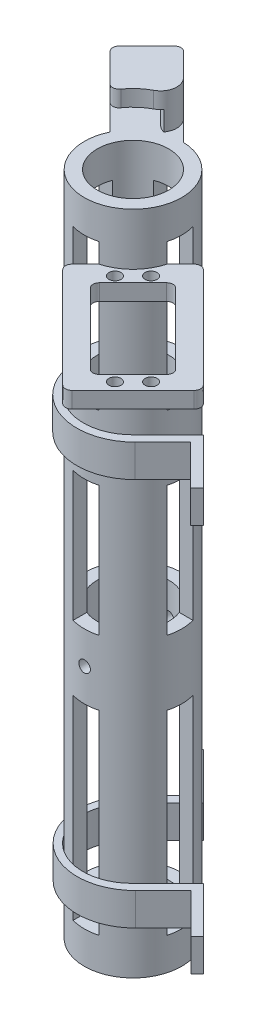
from build123d import *

# Parameters (mm, degrees)
SKETCH1_R                            = 19.05
SKETCH1_R_2                          = 13.97
BOSS_EXTRUDE1_DEPTH                  = 260.35
SKETCH2_R                            = 13.97
BOSS_EXTRUDE2_DEPTH                  = 6.35
CUT_EXTRUDE1_DEPTH                   = 264.45690084
CUT_EXTRUDE1_DEPTH_BACK              = 264.45690084
SKETCH3_R                            = 2.2479
CUT_EXTRUDE5_DEPTH                   = 262.740190953
CUT_EXTRUDE5_DEPTH_BACK              = 262.740190953
SKETCH5_W                            = 10.16
SKETCH5_H                            = 76.2
SKETCH5_H_2                          = 50.8
SKETCH5_H_3                          = 57.15
CUT_EXTRUDE6_DEPTH                   = 262.740190953
CUT_EXTRUDE6_DEPTH_BACK              = 262.740190953
SKETCH8_W                            = 10.16
SKETCH8_H                            = 76.2
SKETCH8_H_2                          = 50.8
SKETCH8_H_3                          = 57.15
SKETCH7_R                            = 6.35
CUT_EXTRUDE4_DEPTH                   = 256.424754201
SKETCH9_W                            = 38.862
SKETCH9_H                            = 6.35
BOSS_EXTRUDE3_DEPTH                  = 8.89
SKETCH10_W                           = 7.62
SKETCH10_H                           = 6.35
BOSS_EXTRUDE4_DEPTH                  = 51.562
BOSS_EXTRUDE5_REACH                  = 279.895
SKETCH11_W                           = 7.62
SKETCH11_H                           = 6.35
FILLET1_R                            = 2.54
CUT_EXTRUDE7_REACH                   = 260.109
SKETCH12_R                           = 2.35585
SKETCH17_W                           = 20.32
SKETCH17_H                           = 6.35
BOSS_EXTRUDE6_DEPTH                  = 20.32
BOSS_EXTRUDE6_DIRECTION_2_REACH      = 286.223
BOSS_EXTRUDE6_DIRECTION_2_END_RADIUS = 19.05
BOSS_EXTRUDE8_DEPTH                  = 13.97
CUT_EXTRUDE8_START                   = -13.97
CUT_EXTRUDE8_DEPTH                   = 7.62
FILLET3_R                            = 2.54
FILLET4_R                            = 6.35
BOSS_EXTRUDE9_DEPTH                  = 12.7
FILLET7_R                            = 19.304
FILLET8_RADIUS                       = 22.733
FILLET8_LENGTH                       = 12.7
SKETCH23_R                           = 2.5527
CUT_EXTRUDE9_DEPTH                   = 12.7
BOSS_EXTRUDE10_DEPTH                 = 6.35
BOSS_EXTRUDE10_DEPTH_BACK            = 6.35
FILLET9_R                            = 19.304
FILLET10_RADIUS                      = 22.7965
FILLET10_LENGTH                      = 12.7
SKETCH25_R                           = 2.5527
CUT_EXTRUDE10_DEPTH                  = 6.35


# Some blends are built 0.0001 mm under size
with BuildPart() as part:
    # Sketch1 → Boss-Extrude1 (new body)
    with BuildSketch(Plane(origin=(0, 0, 0), x_dir=(1, 0, 0), z_dir=(0, 1, 0))):
        with Locations(Location((0, 0, 0), (0, 0, 270))):
            Circle(SKETCH1_R)
        with Locations(Location((0, 0, 0), (0, 0, 270))):
            Circle(SKETCH1_R_2, mode=Mode.SUBTRACT)
    extrude(amount=BOSS_EXTRUDE1_DEPTH)

    # Sketch2 → Boss-Extrude2 (add)
    with BuildSketch(Plane.XZ):
        with Locations(Location((0, 0, 0), (0, 0, 270))):
            Circle(SKETCH2_R)
    extrude(amount=-BOSS_EXTRUDE2_DEPTH)

    # Sketch3 → Cut-Extrude1 (cut, two sides: drawn at the far end of the back side and taken through both)
    with BuildSketch(Plane.XY.offset(16.51).offset(-CUT_EXTRUDE1_DEPTH_BACK)):
        with Locations((0, 101.6)):
            Circle(SKETCH3_R)
    extrude(amount=CUT_EXTRUDE1_DEPTH + CUT_EXTRUDE1_DEPTH_BACK, mode=Mode.SUBTRACT)

    # Sketch5 → Cut-Extrude5 (cut, two sides: drawn at the far end of the back side and taken through both)
    with BuildSketch(Plane(origin=(0, 0, 0), x_dir=(0, 0, -1), z_dir=(1, 0, 0)).offset(-CUT_EXTRUDE5_DEPTH_BACK)):
        with Locations((0, 50.8)):
            Rectangle(SKETCH5_W, SKETCH5_H)
        with Locations((0, 139.7)):
            Rectangle(SKETCH5_W, SKETCH5_H_2)
        with Locations((0, 219.075)):
            Rectangle(SKETCH5_W, SKETCH5_H_3)
    extrude(amount=CUT_EXTRUDE5_DEPTH + CUT_EXTRUDE5_DEPTH_BACK, mode=Mode.SUBTRACT)

    # Sketch8 → Cut-Extrude6 (cut, two sides: drawn at the far end of the back side and taken through both)
    with BuildSketch(Plane.XY.offset(-CUT_EXTRUDE6_DEPTH_BACK)):
        with Locations((0, 50.8)):
            Rectangle(SKETCH8_W, SKETCH8_H)
        with Locations((0, 139.7)):
            Rectangle(SKETCH8_W, SKETCH8_H_2)
        with Locations((0, 219.075)):
            Rectangle(SKETCH8_W, SKETCH8_H_3)
    extrude(amount=CUT_EXTRUDE6_DEPTH + CUT_EXTRUDE6_DEPTH_BACK, mode=Mode.SUBTRACT)

    # Sketch7 → Cut-Extrude4 (cut, through all)
    with BuildSketch(Plane(origin=(0, 6.35, 0), x_dir=(1, 0, 0), z_dir=(0, 1, 0))):
        with Locations(Location((0, 0, 0), (0, 0, 270))):
            Circle(SKETCH7_R)
    extrude(amount=-CUT_EXTRUDE4_DEPTH, mode=Mode.SUBTRACT)

    # Sketch9 → Boss-Extrude3 (add)
    with BuildSketch(Plane(origin=(11.720088507, 0, 11.720088507), x_dir=(0.7071067811865485, 0, -0.7071067811865467), z_dir=(0.7071067811865467, 0, 0.7071067811865485))):
        with Locations((0, 236.827)):
            Rectangle(SKETCH9_W, SKETCH9_H)
    extrude(amount=BOSS_EXTRUDE3_DEPTH)

    # Sketch10 → Boss-Extrude4 (add)
    with BuildSketch(Plane(origin=(18.006267792, 0, 18.006267792), x_dir=(0.7071067811865481, 0, -0.707106781186547), z_dir=(0.707106781186547, 0, 0.7071067811865481))):
        with Locations((-15.621, 236.827)):
            Rectangle(SKETCH10_W, SKETCH10_H)
        with Locations((15.621, 236.827)):
            Rectangle(SKETCH10_W, SKETCH10_H)
    extrude(amount=BOSS_EXTRUDE4_DEPTH)

    # Sketch11 → Boss-Extrude5 (add, up to next)
    with BuildSketch(Plane(origin=(-8.351638193, 0, 8.351638193), x_dir=(-0.7071067811865471, 0, -0.7071067811865479), z_dir=(0.7071067811865479, 0, -0.7071067811865471)), mode=Mode.PRIVATE) as boss_extrude5_sk1:
        with Locations((-73.216708119, 236.827)):
            Rectangle(SKETCH11_W, SKETCH11_H)
    boss_extrude5_tool1 = extrude(boss_extrude5_sk1.sketch, amount=BOSS_EXTRUDE5_REACH, mode=Mode.PRIVATE) - part.part
    add(boss_extrude5_tool1.solids().sort_by_distance((43.420393, 236.827, 60.123669))[0])

    # Fillet1
    fillet1_edges = [part.edges().sort_by_distance(p)[0] for p in [
        (-2.019703358, 236.827, 25.459880372),
        (25.459880372, 236.827, -2.019703358),
        (9.654629599, 236.827, 26.357905985),
        (40.726315778, 236.827, 68.205899509),
        (26.357905985, 236.827, 9.654629599),
        (68.205899509, 236.827, 40.726315778),
        (57.429592163, 236.827, 40.726315778),
        (40.726315778, 236.827, 57.429592163),
    ]]
    fillet(fillet1_edges, radius=FILLET1_R)

    # Sketch12 → Cut-Extrude7 (cut, up to next)
    with BuildSketch(Plane(origin=(0, 240.002, 0), x_dir=(1, 0, 0), z_dir=(0, 1, 0)), mode=Mode.PRIVATE) as cut_extrude7_sk1:
        with Locations(Location((48.033763646, -55.104831458, 0), (0, 0, 270))):
            Circle(SKETCH12_R)
    cut_extrude7_tool1 = extrude(cut_extrude7_sk1.sketch, amount=-CUT_EXTRUDE7_REACH, mode=Mode.PRIVATE) & part.part
    # Sketch12 → Cut-Extrude7 (cut, up to next)
    with BuildSketch(Plane(origin=(0, 240.002, 0), x_dir=(1, 0, 0), z_dir=(0, 1, 0)), mode=Mode.PRIVATE) as cut_extrude7_sk2:
        with Locations(Location((55.104831458, -48.033763646, 0), (0, 0, 270))):
            Circle(SKETCH12_R)
    cut_extrude7_tool2 = extrude(cut_extrude7_sk2.sketch, amount=-CUT_EXTRUDE7_REACH, mode=Mode.PRIVATE) & part.part
    # Sketch12 → Cut-Extrude7 (cut, up to next)
    with BuildSketch(Plane(origin=(0, 240.002, 0), x_dir=(1, 0, 0), z_dir=(0, 1, 0)), mode=Mode.PRIVATE) as cut_extrude7_sk3:
        with Locations(Location((19.254517652, -12.18344984, 0), (0, 0, 270))):
            Circle(SKETCH12_R)
    cut_extrude7_tool3 = extrude(cut_extrude7_sk3.sketch, amount=-CUT_EXTRUDE7_REACH, mode=Mode.PRIVATE) & part.part
    # Sketch12 → Cut-Extrude7 (cut, up to next)
    with BuildSketch(Plane(origin=(0, 240.002, 0), x_dir=(1, 0, 0), z_dir=(0, 1, 0)), mode=Mode.PRIVATE) as cut_extrude7_sk4:
        with Locations(Location((12.18344984, -19.254517652, 0), (0, 0, 270))):
            Circle(SKETCH12_R)
    cut_extrude7_tool4 = extrude(cut_extrude7_sk4.sketch, amount=-CUT_EXTRUDE7_REACH, mode=Mode.PRIVATE) & part.part
    add(cut_extrude7_tool1.solids().sort_by_distance((48.033764, 240.002, 55.104831))[0], mode=Mode.SUBTRACT)
    add(cut_extrude7_tool2.solids().sort_by_distance((55.104831, 240.002, 48.033764))[0], mode=Mode.SUBTRACT)
    add(cut_extrude7_tool3.solids().sort_by_distance((19.254518, 240.002, 12.18345))[0], mode=Mode.SUBTRACT)
    add(cut_extrude7_tool4.solids().sort_by_distance((12.18345, 240.002, 19.254518))[0], mode=Mode.SUBTRACT)

    # Sketch17 → Boss-Extrude6 (add)
    with BuildSketch(Plane(origin=(-13.470384182, 0, -13.470384182), x_dir=(-0.707106781186548, 0, 0.7071067811865471), z_dir=(-0.7071067811865471, 0, -0.707106781186548))):
        with Locations((-3.81, 257.175)):
            Rectangle(SKETCH17_W, SKETCH17_H)
    extrude(amount=BOSS_EXTRUDE6_DEPTH)

    # Boss-Extrude6 direction 2: up to this cylinder (the profile starts outside it)
    boss_extrude6_direction_2_end = Plane(origin=(0, 257.175, 0), z_dir=(0, -1, 0)) * Cylinder(BOSS_EXTRUDE6_DIRECTION_2_END_RADIUS, 611.546, mode=Mode.PRIVATE)
    # Sketch17 → Boss-Extrude6 direction 2 (add, up to the surface)
    with BuildSketch(Plane(origin=(-13.470384182, 0, -13.470384182), x_dir=(-0.707106781186548, 0, 0.7071067811865471), z_dir=(-0.7071067811865471, 0, -0.707106781186548)), mode=Mode.PRIVATE) as boss_extrude6_direction_2_sk1:
        with Locations((-3.81, 257.175)):
            Rectangle(SKETCH17_W, SKETCH17_H)
    boss_extrude6_direction_2_tool1 = extrude(boss_extrude6_direction_2_sk1.sketch, amount=-BOSS_EXTRUDE6_DIRECTION_2_REACH, mode=Mode.PRIVATE) - boss_extrude6_direction_2_end
    add(boss_extrude6_direction_2_tool1.solids().sort_by_distance((-10.776307, 257.175, -16.164461))[0])
    add(boss_extrude6_direction_2_tool1.solids().sort_by_distance((-10.776307, 257.175, -16.164461))[1])

    # Sketch20 → Boss-Extrude8 (add)
    with BuildSketch(Plane(origin=(0, 260.35, 0), x_dir=(1, 0, 0), z_dir=(0, 1, 0))):
        with BuildLine():
            Line((0.720181493, 19.036381973), (-17.960512242, 37.717075708))
            Line((-17.960512242, 37.717075708), (-32.328922036, 23.348665915))
            Line((-32.328922036, 23.348665915), (-17.190128061, 8.209871939))
            ThreePointArc((-17.190128061, 8.209871939), (-9.854852351, 16.302894993), (0.720181493, 19.036381973))
        make_face()
    extrude(amount=BOSS_EXTRUDE8_DEPTH)

    # Sketch21 → Cut-Extrude8 (cut)
    with BuildSketch(Plane(origin=(0, 274.32, 0), x_dir=(1, 0, 0), z_dir=(0, 1, 0)).offset(CUT_EXTRUDE8_START)):
        with BuildLine():
            Line((-27.838793975, 18.858537854), (-17.960512242, 28.736819587))
            Line((-17.960512242, 28.736819587), (-6.957657358, 17.733964703))
            ThreePointArc((-6.957657358, 17.733964703), (-12.979058937, 13.944408525), (-17.190128061, 8.209871939))
            Line((-17.190128061, 8.209871939), (-27.838793975, 18.858537854))
        make_face()
    extrude(amount=CUT_EXTRUDE8_DEPTH, mode=Mode.SUBTRACT)

    # Fillet3
    # the kernel refuses this fillet: 2.54 mm, written as the material it takes off along each edge
    with BuildSketch(Plane(origin=(-32.328922036, 260.35, -23.348665915), x_dir=(0.7071067811865468, 0, 0.7071067811865482), z_dir=(0, 1, 0))) as fillet3_piece_1:
        with BuildLine():
            CenterArc((FILLET3_R, FILLET3_R), FILLET3_R, 180, 90)
            Line((0, FILLET3_R), (0, 0))
            Line((0, 0), (FILLET3_R, 0))
        make_face()
    extrude(amount=20.32, mode=Mode.SUBTRACT)
    with BuildSketch(Plane(origin=(-17.960512242, 260.35, -37.717075708), x_dir=(0.7071067811865469, 0, 0.7071067811865482), z_dir=(0, 1, 0))) as fillet3_piece_2:
        with BuildLine():
            CenterArc((FILLET3_R, -FILLET3_R), FILLET3_R, 90, 90)
            Line((0, -FILLET3_R), (0, 0))
            Line((0, 0), (FILLET3_R, 0))
        make_face()
    extrude(amount=20.32, mode=Mode.SUBTRACT)
    with BuildSketch(Plane(origin=(-17.190128061, 267.97, -8.209871939), x_dir=(0.5027524055877951, 0, -0.8644304591323035), z_dir=(0, 1, 0))) as fillet3_piece_3:
        with BuildLine():
            CenterArc((3.297098378, 2.531627088), FILLET3_R, 165.182265372, 100.164248622)
            Line((0.84156792, 3.181219399), (0, 0))
            ThreePointArc((0, 0), (1.545514865, 0.062796841), (3.091029729, 0))
        make_face()
    extrude(amount=14.57663108, mode=Mode.SUBTRACT)
    with BuildSketch(Plane(origin=(-27.838793975, 260.35, -18.858537854), x_dir=(-0.707106781186549, 0, -0.7071067811865461), z_dir=(0, 1, 0))) as fillet3_piece_4:
        with BuildLine():
            CenterArc((FILLET3_R, -FILLET3_R), FILLET3_R, 90, 90)
            Line((0, -FILLET3_R), (0, 0))
            Line((0, 0), (FILLET3_R, 0))
        make_face()
    extrude(amount=7.62, mode=Mode.SUBTRACT)
    with BuildSketch(Plane(origin=(-17.960512242, 260.35, -37.717075708), x_dir=(0.7071067811865461, 0, 0.7071067811865489), z_dir=(0, -1, 0)), Plane(origin=(-32.328922036, 247.65, -23.348665915), x_dir=(0.7071067811865475, 0, 0.7071067811865475), z_dir=(0, 1, 0))) as fillet3_piece_5:
        with BuildLine():
            CenterArc((FILLET3_R, FILLET3_R), FILLET3_R, 180, 90)
            Line((0, FILLET3_R), (0, 0))
            Line((0, 0), (FILLET3_R, 0))
        make_face()
    extrude(amount=12.7, mode=Mode.SUBTRACT)

    # Fillet4
    # the kernel refuses this fillet: 6.35 mm, written as the material it takes off along each edge
    with BuildSketch(Plane(origin=(-6.957657358, 260.35, -17.733964703), x_dir=(0.9586837821239451, 0, -0.28447391074143913), z_dir=(0, 1, 0))) as fillet4_piece_1:
        with BuildLine():
            CenterArc((3.79246695, 6.326845451), FILLET4_R, 208.472595724, 56.632987031)
            Line((-1.789470291, 3.299556788), (0, 0))
            ThreePointArc((0, 0), (1.625342978, 0.069463648), (3.250685957, 0))
        make_face()
    extrude(amount=7.62, mode=Mode.SUBTRACT)
    with BuildSketch(Plane(origin=(0.720181493, 260.35, -19.036381973), x_dir=(-0.9755809025693717, 0, 0.2196403936937157), z_dir=(0, 1, 0))) as fillet4_piece_2:
        with BuildLine():
            CenterArc((11.395425399, -6.137783253), FILLET4_R, 104.854484405, 107.457603124)
            Line((6.028728718, -9.532052944), (0, 0))
            ThreePointArc((0, 0), (4.883753742, -0.63665024), (9.767507485, 0))
        make_face()
    extrude(amount=42.166365379, mode=Mode.SUBTRACT)


with BuildPart() as body_2:
    # Sketch22 → Boss-Extrude9 (new body)
    with BuildSketch(Plane(origin=(0, 19.550000016, 0), x_dir=(-1, 0, 0), z_dir=(0, -1, 0))):
        Polygon((-45.365156433, -17.885572703), (-27.404644191, 0.074939539), (-0.463875828, -26.865828824), (0.127956848, -27.4576615), (27.427935456, -0.157682892), (26.83610278, 0.434149784), (-0.104665583, 27.374918147), (17.855846659, 45.33543039), (20.280515812, 42.910761237), (4.744672722, 27.374918147), (31.685441086, 0.434149784), (-0.463875828, -31.715167129), (-27.404644191, -4.774398766), (-42.940487281, -20.310241855), align=None)
    extrude(amount=-BOSS_EXTRUDE9_DEPTH)

    # Fillet7
    fillet7_edges = [body_2.edges().sort_by_distance(p)[0] for p in [
        (-0.127956848, 25.900000016, 27.4576615),
        (-27.427935456, 25.900000016, 0.157682892),
    ]]
    fillet(fillet7_edges, radius=FILLET7_R - 0.0001)  # a hair under: the kernel refuses the full size

    # Fillet8: full round fillet: the end face becomes a half cylinder, R = half its width
    fillet8_face = Plane((-15.610782629, 25.900000016, 15.640508673), x_dir=(0, -1, 0), z_dir=(-0.707106781187, 0, 0.707106781187))  # on the end face: x along it, z out of the body
    fillet8_slab = fillet8_face.offset(-FILLET8_RADIUS / 2) * Box(FILLET8_LENGTH, 2 * FILLET8_RADIUS, FILLET8_RADIUS, mode=Mode.PRIVATE)  # the body's end, R deep
    fillet8_round = Plane((0.463875828, 25.900000016, -0.434149784), x_dir=(-0.707106781187, 0, 0.707106781187), z_dir=(0, -1, 0)) * Cylinder(FILLET8_RADIUS, FILLET8_LENGTH, mode=Mode.PRIVATE)  # its axis R under the face
    add(fillet8_slab - fillet8_round, mode=Mode.SUBTRACT)

    # Sketch23 → Cut-Extrude9 (cut)
    with BuildSketch(Plane(origin=(11.315122713, 0, -11.315122713), x_dir=(0.7071067811865479, 0, 0.7071067811865472), z_dir=(-0.7071067811865472, 0, 0.7071067811865479))):
        with Locations((26.564019487, 25.900000016)):
            Circle(SKETCH23_R)
        with Locations((-26.521980513, 25.900000016)):
            Circle(SKETCH23_R)
    extrude(amount=-CUT_EXTRUDE9_DEPTH, mode=Mode.SUBTRACT)


with BuildPart() as body_3:
    # Sketch24 → Boss-Extrude10 (new, two sides: drawn at the far end of the back side and taken through both)
    with BuildSketch(Plane(origin=(0, 177.8, 0), x_dir=(-1, 0, 0), z_dir=(0, -1, 0)).offset(-BOSS_EXTRUDE10_DEPTH_BACK)):
        Polygon((-45.365156433, -17.885572703), (-27.404644191, 0.074939539), (-0.431018038, -26.898686614), (0.014364825, -27.344069477), (27.314343433, -0.044090869), (26.86896057, 0.401291994), (0, 27.270252564), (17.855846659, 45.33543039), (20.339766433, 42.880293162), (4.924791282, 27.284602149), (31.808101436, 0.401291994), (-0.431018038, -31.83782748), (-27.404644191, -4.864201327), (-42.895586, -20.355143136), align=None)
    extrude(amount=BOSS_EXTRUDE10_DEPTH + BOSS_EXTRUDE10_DEPTH_BACK)

    # Fillet9
    fillet9_edges = [body_3.edges().sort_by_distance(p)[0] for p in [
        (-0.014364825, 177.8, 27.344069477),
        (-27.314343433, 177.8, 0.044090869),
    ]]
    fillet(fillet9_edges, radius=FILLET9_R - 0.0001)  # a hair under: the kernel refuses the full size

    # Fillet10: full round fillet: the end face becomes a half cylinder, R = half its width
    fillet10_face = Plane((-15.688541699, 177.8, 15.718267743), x_dir=(0, -1, 0), z_dir=(-0.707106781187, 0, 0.707106781187))  # on the end face: x along it, z out of the body
    fillet10_slab = fillet10_face.offset(-FILLET10_RADIUS / 2) * Box(FILLET10_LENGTH, 2 * FILLET10_RADIUS, FILLET10_RADIUS, mode=Mode.PRIVATE)  # the body's end, R deep
    fillet10_round = Plane((0.431018038, 177.8, -0.401291994), x_dir=(-0.707106781187, 0, 0.707106781187), z_dir=(0, -1, 0)) * Cylinder(FILLET10_RADIUS, FILLET10_LENGTH, mode=Mode.PRIVATE)  # its axis R under the face
    add(fillet10_slab - fillet10_round, mode=Mode.SUBTRACT)

    # Sketch25 → Cut-Extrude10 (cut)
    with BuildSketch(Plane(origin=(11.150280436, 0, -11.021075995), x_dir=(0.7029741524658759, 0, 0.7112153970246169), z_dir=(-0.7112153970246169, 0, 0.7029741524658759))):
        with Locations((-26.677230128, 177.8)):
            Circle(SKETCH25_R)
        with Locations(Location((26.534251402, 177.8, 0), (0, 0, 180))):
            Circle(SKETCH25_R)
    extrude(amount=-CUT_EXTRUDE10_DEPTH, mode=Mode.SUBTRACT)


solid = Compound([part.part, body_2.part, body_3.part])
